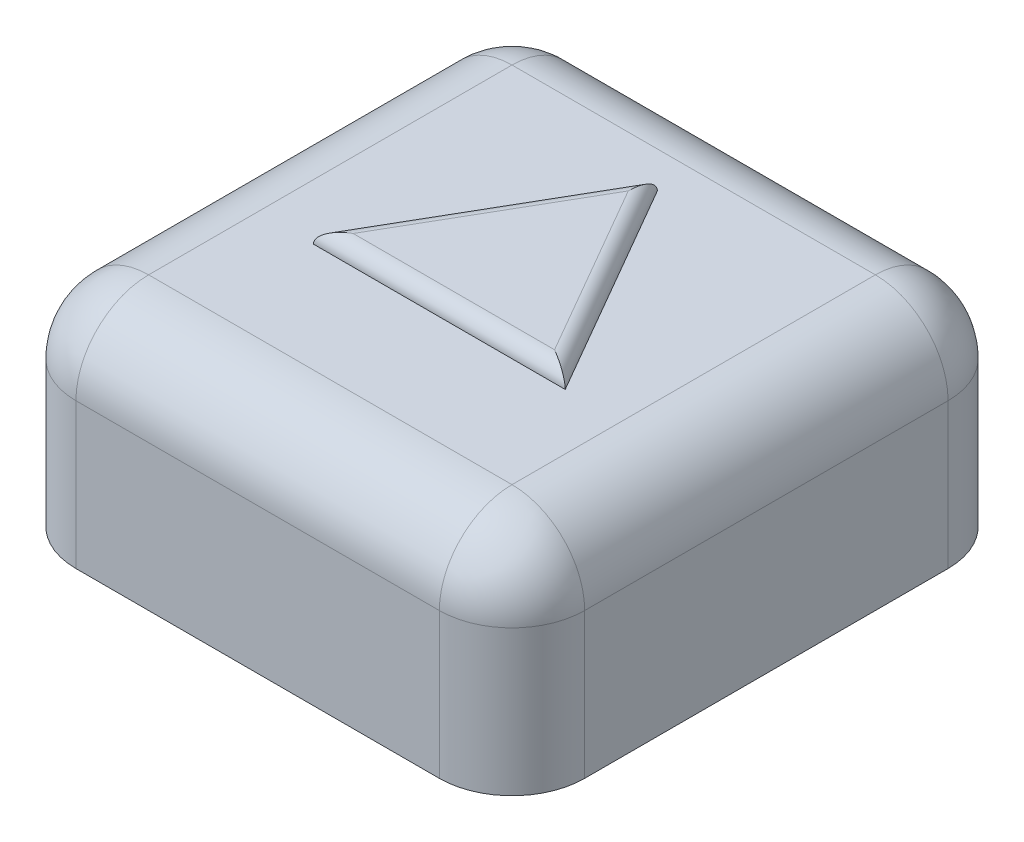
from build123d import *

# Parameters (mm, degrees)
SKETCH1_W           = 7
SKETCH1_H           = 7
BOSS_EXTRUDE1_DEPTH = 3
FILLET1_R           = 1
BOSS_EXTRUDE2_DEPTH = 0.2
FILLET2_R           = 0.2


with BuildPart() as part:
    # Sketch1 → Boss-Extrude1 (new body)
    with BuildSketch(Plane(origin=(0, 0, 0), x_dir=(1, 0, 0), z_dir=(0, 1, 0))):
        Rectangle(SKETCH1_W, SKETCH1_H)
    extrude(amount=BOSS_EXTRUDE1_DEPTH)

    # Fillet1
    fillet1_edges = [part.edges().sort_by_distance(p)[0] for p in [
        (-3.5, 3, 0),
        (0, 3, 3.5),
        (3.5, 3, 0),
        (0, 3, -3.5),
        (3.5, 1.5, 3.5),
        (-3.5, 1.5, 3.5),
        (-3.5, 1.5, -3.5),
        (3.5, 1.5, -3.5),
    ]]
    fillet(fillet1_edges, radius=FILLET1_R)

    # Sketch2 → Boss-Extrude2 (add)
    with BuildSketch(Plane(origin=(0, 3, 0), x_dir=(1, 0, 0), z_dir=(0, 1, 0))):
        Polygon((0, 2), (-1.732050808, -1), (1.732050808, -1), align=None)
    extrude(amount=BOSS_EXTRUDE2_DEPTH)

    # Fillet2
    fillet2_edges = [part.edges().sort_by_distance(p)[0] for p in [
        (-0.866025404, 3.2, -0.5),
        (0.866025404, 3.2, -0.5),
        (0, 3.2, 1),
    ]]
    fillet(fillet2_edges, radius=FILLET2_R - 0.0001)  # a hair under: the kernel refuses the full size


solid = part.part
